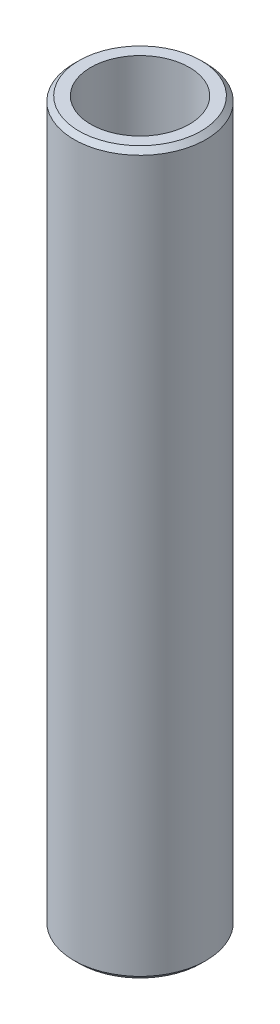
from build123d import *

# Parameters (mm, degrees)
SKETCH1_R           = 45
BOSS_EXTRUDE1_DEPTH = 491.695548875
SKETCH2_R           = 33.646469168
CUT_EXTRUDE1_DEPTH  = 496.796846282
CHAMFER1_SIZE       = 3.331695959


with BuildPart() as part:
    # Sketch1 → Boss-Extrude1 (new body)
    with BuildSketch(Plane(origin=(0, 0, 0), x_dir=(1, 0, 0), z_dir=(0, 1, 0))):
        Circle(SKETCH1_R)
    extrude(amount=BOSS_EXTRUDE1_DEPTH)

    # Sketch2 → Cut-Extrude1 (cut, through all)
    with BuildSketch(Plane(origin=(0, 0, 0), x_dir=(1, 0, 0), z_dir=(0, 1, 0))):
        Circle(SKETCH2_R)
    extrude(amount=CUT_EXTRUDE1_DEPTH, mode=Mode.SUBTRACT)

    # Chamfer1
    chamfer1_edges = [part.edges().sort_by_distance(p)[0] for p in [
        (-45, 491.695548875, 0),
        (-45, 0, 0),
    ]]
    chamfer(chamfer1_edges, length=CHAMFER1_SIZE)


solid = part.part
